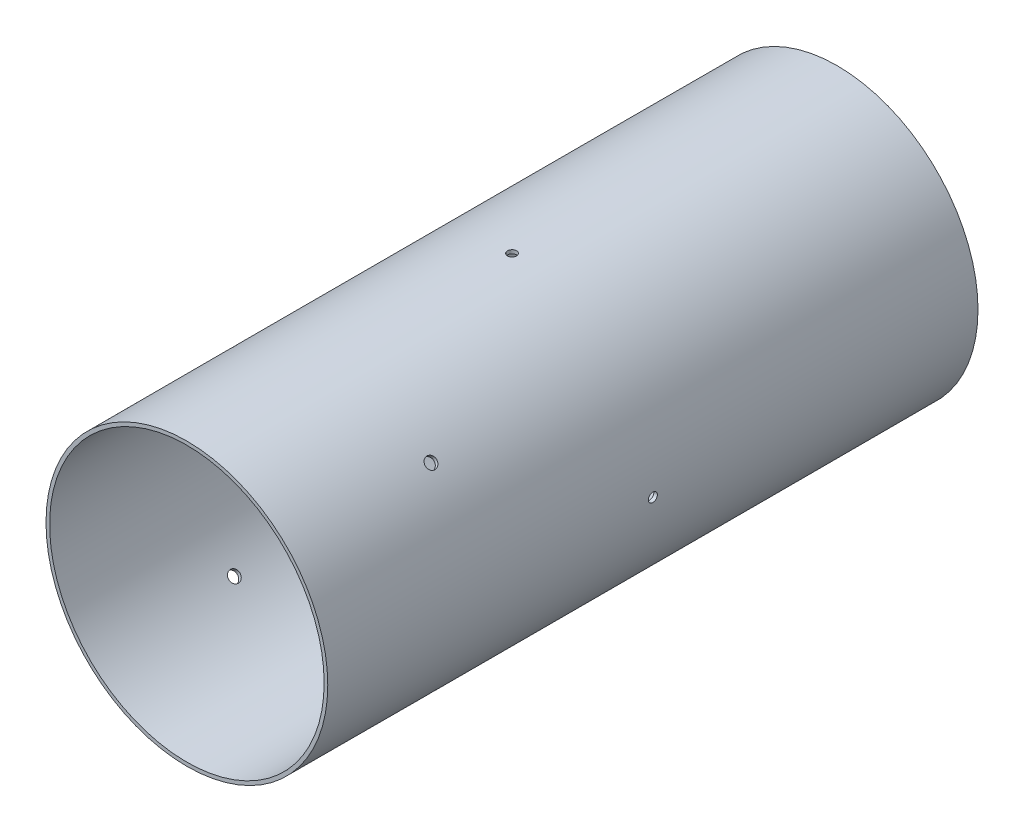
from build123d import *

# Parameters (mm, degrees)
SKETCH1_R           = 49.53
SKETCH1_R_2         = 48.26
BOSS_EXTRUDE1_DEPTH = 228.6
SKETCH2_R           = 1.984375
CUT_EXTRUDE1_DEPTH  = 12.7
CIRPATTERN1_COUNT   = 4
SKETCH3_R           = 2.38125
CUT_EXTRUDE2_DEPTH  = 25.4
SKETCH4_R           = 1.5875
CUT_EXTRUDE3_DEPTH  = 37.338
CIRPATTERN2_COUNT   = 4
SKETCH5_R           = 1.0922
CUT_EXTRUDE4_DEPTH  = 25.4
CIRPATTERN3_COUNT   = 2


with BuildPart() as part:
    # Sketch1 → Boss-Extrude1 (new body)
    with BuildSketch(Plane.XY):
        Circle(SKETCH1_R)
        Circle(SKETCH1_R_2, mode=Mode.SUBTRACT)
    extrude(amount=BOSS_EXTRUDE1_DEPTH)

    # Sketch2 → Cut-Extrude1 (cut)
    with BuildSketch(Plane(origin=(-120.58027232, -48.738223352, -78.995371644), x_dir=(0.7071067811865487, 0.7071067811865465, 0), z_dir=(-0.7071067811865465, 0.7071067811865487, 0))):
        with Locations((119.72625647, -256.795371644)):
            Circle(SKETCH2_R)
    cut_extrude1 = extrude(amount=-CUT_EXTRUDE1_DEPTH, mode=Mode.SUBTRACT)

    # CirPattern1: Cut-Extrude1 ×4 about axis
    cirpattern1_axis = Axis((0, 0, 0), (0, 0, -1))
    for i in range(1, CIRPATTERN1_COUNT):
        add(cut_extrude1.rotate(cirpattern1_axis, i * 360 / CIRPATTERN1_COUNT), mode=Mode.SUBTRACT)

    # Sketch3 → Cut-Extrude2 (cut)
    with BuildSketch(Plane(origin=(-108.021767186, -85.49918909, -79.333156205), x_dir=(0, 0, 1), z_dir=(-0.8660254037844379, 0.5000000000000014, 0))):
        with Locations((196.808156205, 128.055353348)):
            Circle(SKETCH3_R)
        with Locations((190.458156205, 128.055353348)):
            Circle(SKETCH3_R)
    extrude(amount=-CUT_EXTRUDE2_DEPTH, mode=Mode.SUBTRACT)

    # Sketch4 → Cut-Extrude3 (cut)
    with BuildSketch(Plane(origin=(-33.663219436, -130.56478129, -80.778194099), x_dir=(0, 0, -1), z_dir=(1, 0, 0))):
        with Locations((-195.078194099, 130.56478129)):
            Circle(SKETCH4_R)
    cut_extrude3 = extrude(amount=-CUT_EXTRUDE3_DEPTH, mode=Mode.SUBTRACT)

    # CirPattern2: Cut-Extrude3 ×4 about axis
    cirpattern2_axis = Axis((0, 0, 228.6), (0, 0, -1))
    for i in range(1, CIRPATTERN2_COUNT):
        add(cut_extrude3.rotate(cirpattern2_axis, i * 360 / CIRPATTERN2_COUNT), mode=Mode.SUBTRACT)

    # Sketch5 → Cut-Extrude4 (cut)
    with BuildSketch(Plane(origin=(-120.58027232, -48.738223352, -78.995371644), x_dir=(0.7071067811865487, 0.7071067811865465, 0), z_dir=(-0.7071067811865465, 0.7071067811865487, 0))):
        with Locations((119.72625647, -129.795371644)):
            Circle(SKETCH5_R)
    cut_extrude4 = extrude(amount=-CUT_EXTRUDE4_DEPTH, mode=Mode.SUBTRACT)

    # CirPattern3: Cut-Extrude4 ×2 about axis
    cirpattern3_axis = Axis((0, 0, 0), (0, 0, -1))
    for i in range(1, CIRPATTERN3_COUNT):
        add(cut_extrude4.rotate(cirpattern3_axis, i * 360 / CIRPATTERN3_COUNT), mode=Mode.SUBTRACT)


solid = part.part
